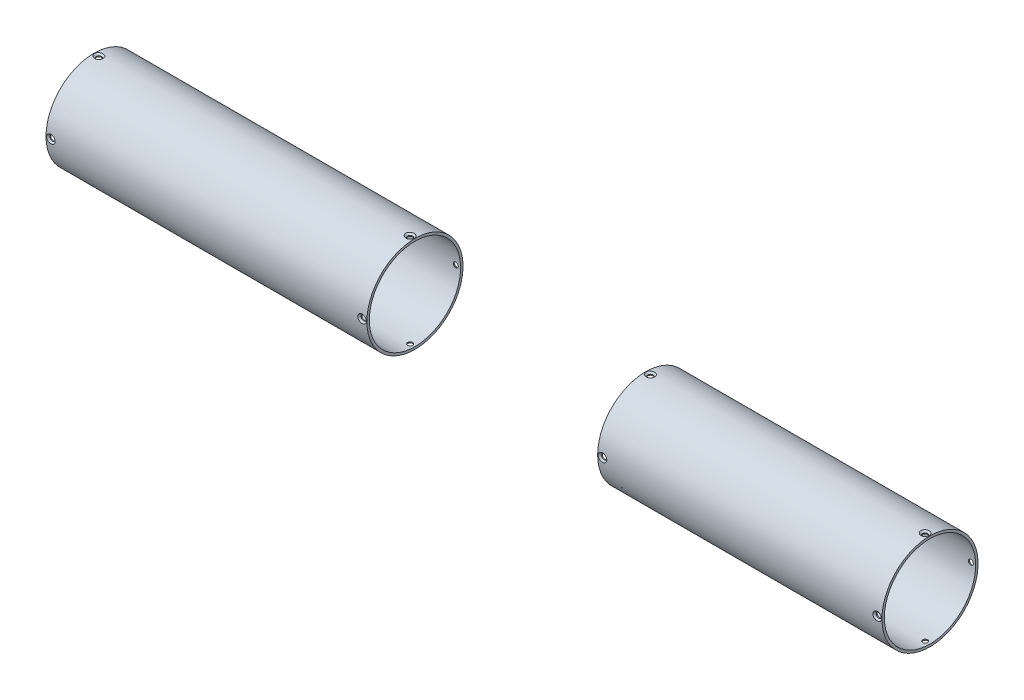
from build123d import *

# Parameters (mm, degrees)
CUT_EXTRUDE1_DEPTH                        = 662.525604191
CUT_EXTRUDE1_DEPTH_BACK                   = 662.525604191
SKETCH2_W                                 = 76.2
SKETCH2_H                                 = 63.5
SKETCH2_W_2                               = 152.4
SKETCH2_W_3                               = 31.75
CSK_FOR_4_FLAT_HEAD_MACHINE_SCREW_2_COUNT = 2
CSK_FOR_4_FLAT_HEAD_MACHINE_SCREW_2_PITCH = 205.55
CIRPATTERN1_COUNT                         = 4


# Read off the part's stored shape, not the designer's step: CSK for #4 Flat Head Machine Screw (100)2
with BuildPart() as part:
    # rootSketch → Revolve1 (revolve)
    with BuildSketch(Plane(origin=(0, 0, 0), x_dir=(1, 0, 0), z_dir=(0, 1, 0))):
        with BuildLine():
            Line((31.75, -31.75), (660, -31.75))
            Line((660, -31.75), (660, -30.1498))
            Line((660, -30.1498), (660, 0))
            Line((660, 0), (1.6002, 0))
            Line((1.6002, 0), (0, 0))
            ThreePointArc((0, 0), (9.299359697, -22.450640303), (31.75, -31.75))
        make_face()
    revolve(axis=Axis((0, 0, 0), (1, 0, 0)))

    # Sketch1 → Cut-Revolve1 (revolve, cut)
    with BuildSketch(Plane(origin=(0, 0, 0), x_dir=(1, 0, 0), z_dir=(0, 1, 0))):
        with BuildLine():
            Line((660, 0), (660, -30.1498))
            Line((660, -30.1498), (31.75, -30.1498))
            ThreePointArc((31.75, -30.1498), (10.430871969, -21.319128031), (1.6002, 0))
            Line((1.6002, 0), (660, 0))
        make_face()
    revolve(axis=Axis((1.6002, 0, 0), (1, 0, 0)), mode=Mode.SUBTRACT)

    # Sketch2 → Cut-Extrude1 (cut, two sides: drawn at the far end of the back side and taken through both)
    with BuildSketch(Plane(origin=(0, 0, 0), x_dir=(1, 0, 0), z_dir=(0, 1, 0)).offset(-CUT_EXTRUDE1_DEPTH_BACK)):
        with Locations((621.9, 0)):
            Rectangle(SKETCH2_W, SKETCH2_H)
        with Locations((319.85, 0)):
            Rectangle(SKETCH2_W_2, SKETCH2_H)
        with Locations((15.875, 0)):
            Rectangle(SKETCH2_W_3, SKETCH2_H)
    extrude(amount=CUT_EXTRUDE1_DEPTH + CUT_EXTRUDE1_DEPTH_BACK, mode=Mode.SUBTRACT)


with BuildPart() as cut_extrude1_piece_1:
    # of the separate pieces the step leaves, piece 1, a body of its own (cut_extrude1_pieces)
    add(part.part.solids().sort_by_distance((31.75, 0, 31.75))[0])

    # Sketch3 → CSK for _4 Flat Head Machine Screw _100 (revolve, cut)
    with BuildSketch(Plane(origin=(240.475, 0, 31.75), x_dir=(0, -1, 0), z_dir=(1, 0, 0))):
        Polygon((0, 0), (0, 31.75), (1.63195, 31.75), (1.63195, 1.028358553), (2.8575, 0), align=None)
    csk_for_4_flat_head_machine_screw_100 = revolve(axis=Axis((240.475, 0, 38.1), (0, 0, -1)), mode=Mode.SUBTRACT)

    # CSK for _4 Flat Head Machine Screw _ 2: CSK for _4 Flat Head Machine Screw _100 ×2
    with Locations(*[(-i * CSK_FOR_4_FLAT_HEAD_MACHINE_SCREW_2_PITCH, 0, 0) for i in range(1, CSK_FOR_4_FLAT_HEAD_MACHINE_SCREW_2_COUNT)]):
        add(csk_for_4_flat_head_machine_screw_100, mode=Mode.SUBTRACT)


with BuildPart() as cut_extrude1_piece_2:
    # of the separate pieces the step leaves, piece 2, a body of its own (cut_extrude1_pieces)
    add(part.part.solids().sort_by_distance((396.05, 0, 31.75))[0])

    # CSK for _4 Flat Head Machine Screw _ 3 o → CSK for _4 Flat Head Machine Screw _ 3 (revolve, cut)
    with BuildSketch(Plane(origin=(580.625, 0, 0), x_dir=(1, 0, 0), z_dir=(0, -1, 0))):
        Polygon((0, 30.105581528), (1.63195, 30.105581528), (1.63195, 30.721641447), (2.857500119, 31.7500001), (0, 31.7500001), align=None)
    csk_for_4_flat_head_machine_screw_3 = revolve(axis=Axis((580.625, 0, 0), (0, 0, 1)), mode=Mode.SUBTRACT)

    # CSK for _4 Flat Head Machine Screw _ 4 → CSK for _4 Flat Head Machine Screw _ 3 2 (revolve, cut)
    with BuildSketch(Plane(origin=(399.225, 0, 0), x_dir=(1, 0, 0), z_dir=(0, -1, 0))):
        Polygon((0, 30.105581528), (1.63195, 30.105581528), (1.63195, 30.721641447), (2.857500119, 31.7500001), (0, 31.7500001), align=None)
    csk_for_4_flat_head_machine_screw_3_2 = revolve(axis=Axis((399.225, 0, 0), (0, 0, 1)), mode=Mode.SUBTRACT)


with BuildPart() as cirpattern1_tool:
    # CirPattern1: CSK for _4 Flat Head Machine Screw _100, CSK for _4 Flat Head Machine Screw _ 3, CSK for _4 Flat Head Machine Screw _ 3 2 ×4 about axis
    cirpattern1_axis = Axis((243.65, 0, 0), (-1, 0, 0))
    add([csk_for_4_flat_head_machine_screw_100.rotate(cirpattern1_axis, i * 360 / CIRPATTERN1_COUNT) for i in range(1, CIRPATTERN1_COUNT)])
    add([csk_for_4_flat_head_machine_screw_3.rotate(cirpattern1_axis, i * 360 / CIRPATTERN1_COUNT) for i in range(1, CIRPATTERN1_COUNT)])
    add([csk_for_4_flat_head_machine_screw_3_2.rotate(cirpattern1_axis, i * 360 / CIRPATTERN1_COUNT) for i in range(1, CIRPATTERN1_COUNT)])


with BuildPart() as cut_extrude1_piece_1_1:
    add(cut_extrude1_piece_1.part)

    # CirPattern1: cut by cirpattern1_tool
    add(cirpattern1_tool.part, mode=Mode.SUBTRACT)

    # CirPattern1 copy 1 sketch → CirPattern1 copy 1 (revolve, cut)
    with BuildSketch(Plane(origin=(34.925, 31.75, 0), x_dir=(0, 0, 1), z_dir=(1, 0, 0))):
        Polygon((0, 0), (0, 31.75), (1.63195, 31.75), (1.63195, 1.028358553), (2.8575, 0), align=None)
    revolve(axis=Axis((34.925, 38.1, 0), (0, -1, 0)), mode=Mode.SUBTRACT)

    # CirPattern1 copy 2 sketch → CirPattern1 copy 2 (revolve, cut)
    with BuildSketch(Plane(origin=(34.925, 0, -31.75), x_dir=(0, 1, 0), z_dir=(1, 0, 0))):
        Polygon((0, 0), (0, 31.75), (1.63195, 31.75), (1.63195, 1.028358553), (2.8575, 0), align=None)
    revolve(axis=Axis((34.925, 0, -38.1), (0, 0, 1)), mode=Mode.SUBTRACT)

    # CirPattern1 copy 3 sketch → CirPattern1 copy 3 (revolve, cut)
    with BuildSketch(Plane(origin=(34.925, -31.75, 0), x_dir=(0, 0, -1), z_dir=(1, 0, 0))):
        Polygon((0, 0), (0, 31.75), (1.63195, 31.75), (1.63195, 1.028358553), (2.8575, 0), align=None)
    revolve(axis=Axis((34.925, -38.1, 0), (0, 1, 0)), mode=Mode.SUBTRACT)


with BuildPart() as cut_extrude1_piece_2_1:
    add(cut_extrude1_piece_2.part)

    # CirPattern1: cut by cirpattern1_tool
    add(cirpattern1_tool.part, mode=Mode.SUBTRACT)


solid = Compound([cut_extrude1_piece_1_1.part, cut_extrude1_piece_2_1.part])
